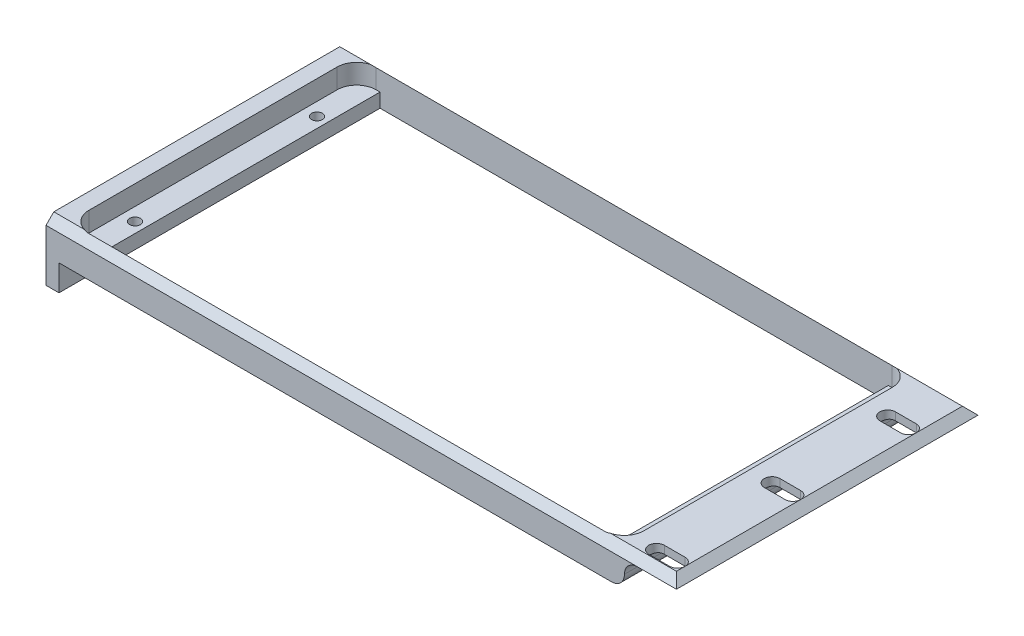
from build123d import *

# Parameters (mm, degrees)
SKETCH1_W                        = 242.5
SKETCH1_H                        = 116
BOSS_EXTRUDE1_DEPTH              = 13
CUT_EXTRUDE1_DEPTH               = 7.6
F_1_8_27_NPSM_TAPPED_HOLE1_D     = 5
F_1_8_27_NPSM_TAPPED_HOLE1_DEPTH = 22.99
F_1_8_27_NPSM_TAPPED_HOLE1_TIP   = 1.502151548
SKETCH6_W                        = 195.5
SKETCH6_H                        = 110.5
CUT_EXTRUDE2_DEPTH               = 143.098592533
SKETCH32_W                       = 20
SKETCH32_H                       = 116
CUT_EXTRUDE10_DEPTH              = 10
FILLET1_START                    = -59
FILLET1_DEPTH                    = 118
FILLET1_START_2                  = -58
FILLET1_2_DEPTH                  = 116
CHAMFER1_SIZE                    = 3
SKETCH36_W                       = 5
SKETCH36_H                       = 116
BOSS_EXTRUDE2_DEPTH              = 10
M5X0_8_TAPPED_HOLE1_D            = 4.2
M5X0_8_TAPPED_HOLE1_DEPTH        = 12.4
M5X0_8_TAPPED_HOLE1_TIP          = 1.2618073
M4X0_7_TAPPED_HOLE1_D            = 3.3
CUT_EXTRUDE11_DEPTH              = 144.747173885


with BuildPart() as part:
    # Sketch1 → Boss-Extrude1 (new body)
    with BuildSketch(Plane(origin=(0, 0, 0), x_dir=(1, 0, 0), z_dir=(0, 1, 0))):
        with Locations((8.25, 0)):
            Rectangle(SKETCH1_W, SKETCH1_H)
    extrude(amount=BOSS_EXTRUDE1_DEPTH)

    # Sketch2 → Cut-Extrude1 (cut)
    with BuildSketch(Plane(origin=(0, 13, 0), x_dir=(1, 0, 0), z_dir=(0, 1, 0))):
        with BuildLine():
            Line((-99.25, 55.25), (99.25, 55.25))
            ThreePointArc((99.25, 55.25), (104.553300859, 53.053300859), (106.75, 47.75))
            Line((106.75, 47.75), (106.75, -47.75))
            ThreePointArc((106.75, -47.75), (104.553300859, -53.053300859), (99.25, -55.25))
            Line((99.25, -55.25), (-99.25, -55.25))
            ThreePointArc((-99.25, -55.25), (-104.553300859, -53.053300859), (-106.75, -47.75))
            Line((-106.75, -47.75), (-106.75, 47.75))
            ThreePointArc((-106.75, 47.75), (-104.553300859, 53.053300859), (-99.25, 55.25))
        make_face()
    extrude(amount=-CUT_EXTRUDE1_DEPTH, mode=Mode.SUBTRACT)

    # 1/8-27 NPSM Tapped Hole1
    with Locations(Plane(origin=(0, 5.4, 0), x_dir=(1, 0, 0), z_dir=(0, 1, 0))):
        with Locations((-74.86, 30.93), (51.34, 30.93), (51.34, -34.72), (-74.86, -34.72)):
            Hole(F_1_8_27_NPSM_TAPPED_HOLE1_D / 2, depth=F_1_8_27_NPSM_TAPPED_HOLE1_DEPTH)
            with Locations((0, 0, -(F_1_8_27_NPSM_TAPPED_HOLE1_DEPTH + F_1_8_27_NPSM_TAPPED_HOLE1_TIP / 2))):  # 118° drill point
                Cone(0, F_1_8_27_NPSM_TAPPED_HOLE1_D / 2, F_1_8_27_NPSM_TAPPED_HOLE1_TIP, mode=Mode.SUBTRACT)

    # Sketch6 → Cut-Extrude2 (cut, through all)
    with BuildSketch(Plane(origin=(0, 5.4, 0), x_dir=(1, 0, 0), z_dir=(0, 1, 0))):
        Rectangle(SKETCH6_W, SKETCH6_H)
    extrude(amount=-CUT_EXTRUDE2_DEPTH, mode=Mode.SUBTRACT)

    # Sketch32 → Cut-Extrude10 (cut)
    with BuildSketch(Plane.XZ):
        with Locations((119.5, 0)):
            Rectangle(SKETCH32_W, SKETCH32_H)
    extrude(amount=-CUT_EXTRUDE10_DEPTH, mode=Mode.SUBTRACT)

    # Fillet1: read off the stored shape, not the designer's step
    # Fillet1 outline → Fillet1 (cut)
    with BuildSketch(Plane.XY.offset(FILLET1_START)):
        with BuildLine():
            Line((109.5, 0), (109.5, 5))
            ThreePointArc((109.5, 5), (108.035533906, 1.464466094), (104.5, 0))
            Line((104.5, 0), (109.5, 0))
        make_face()
    extrude(amount=FILLET1_DEPTH, mode=Mode.SUBTRACT)

    # Fillet1 2 outline → Fillet1 2 (add)
    with BuildSketch(Plane.XY.offset(FILLET1_START_2)):
        with BuildLine():
            ThreePointArc((109.5, 5), (110.964466094, 8.535533906), (114.5, 10))
            Line((114.5, 10), (109.5, 10))
            Line((109.5, 10), (109.5, 5))
        make_face()
    extrude(amount=FILLET1_2_DEPTH)

    # Chamfer1
    # the kernel refuses this chamfer: 3 mm, written as the material it takes off along each edge
    with BuildSketch(Plane(origin=(137.215048964, 13, 58), x_dir=(0, 0, -1), z_dir=(-1, 0, 0))) as chamfer1_piece_1:
        Polygon((CHAMFER1_SIZE, 0), (0, CHAMFER1_SIZE), (0, 0), align=None)
    extrude(amount=257.930097928, mode=Mode.SUBTRACT)
    with BuildSketch(Plane(origin=(129.5, 13, -65.715048964), x_dir=(0, -1, 0), z_dir=(0, 0, 1))) as chamfer1_piece_2:
        Polygon((CHAMFER1_SIZE, 0), (0, -CHAMFER1_SIZE), (0, 0), align=None)
    extrude(amount=131.430097928, mode=Mode.SUBTRACT)
    with BuildSketch(Plane(origin=(-120.715048964, 13, -58), x_dir=(0, -1, 0), z_dir=(1, 0, 0))) as chamfer1_piece_3:
        Polygon((CHAMFER1_SIZE, 0), (0, -CHAMFER1_SIZE), (0, 0), align=None)
    extrude(amount=257.930097928, mode=Mode.SUBTRACT)

    # Sketch36 → Boss-Extrude2 (add)
    with BuildSketch(Plane.XZ):
        with Locations((-110.5, 0)):
            Rectangle(SKETCH36_W, SKETCH36_H)
    extrude(amount=BOSS_EXTRUDE2_DEPTH)

    # M5x0.8 Tapped Hole1
    with Locations(Plane(origin=(0, 5.4, 0), x_dir=(1, 0, 0), z_dir=(0, 1, 0))):
        with Locations((-101.75, 35), (-101.75, -35), (101.75, 35), (101.75, -35)):
            Hole(M5X0_8_TAPPED_HOLE1_D / 2, depth=M5X0_8_TAPPED_HOLE1_DEPTH)
            with Locations((0, 0, -(M5X0_8_TAPPED_HOLE1_DEPTH + M5X0_8_TAPPED_HOLE1_TIP / 2))):  # 118° drill point
                Cone(0, M5X0_8_TAPPED_HOLE1_D / 2, M5X0_8_TAPPED_HOLE1_TIP, mode=Mode.SUBTRACT)

    # M4x0.7 Tapped Hole1 (through all)
    with Locations(Plane(origin=(-108, 0, 0), x_dir=(0, 0, -1), z_dir=(1, 0, 0))):
        with Locations((-15, -4.5), (15, -4.5), (45, -4.5), (-45, -4.5)):
            Hole(M4X0_7_TAPPED_HOLE1_D / 2)

    # Sketch43 → Cut-Extrude11 (cut, through all)
    with BuildSketch(Plane(origin=(0, 13, 0), x_dir=(1, 0, 0), z_dir=(0, 1, 0))):
        with BuildLine():
            Line((115.5, -48.65), (123.5, -48.65))
            ThreePointArc((123.5, -48.65), (126.5, -51.65), (123.5, -54.65))
            Line((123.5, -54.65), (115.5, -54.65))
            ThreePointArc((115.5, -54.65), (112.5, -51.65), (115.5, -48.65))
        make_face()
        with BuildLine():
            Line((115.5, -4.2), (123.5, -4.2))
            ThreePointArc((123.5, -4.2), (126.5, -7.2), (123.5, -10.2))
            Line((123.5, -10.2), (115.5, -10.2))
            ThreePointArc((115.5, -10.2), (112.5, -7.2), (115.5, -4.2))
        make_face()
        with BuildLine():
            Line((115.5, 40.25), (123.5, 40.25))
            ThreePointArc((123.5, 40.25), (126.5, 37.25), (123.5, 34.25))
            Line((123.5, 34.25), (115.5, 34.25))
            ThreePointArc((115.5, 34.25), (112.5, 37.25), (115.5, 40.25))
        make_face()
    extrude(amount=-CUT_EXTRUDE11_DEPTH, mode=Mode.SUBTRACT)


solid = part.part
